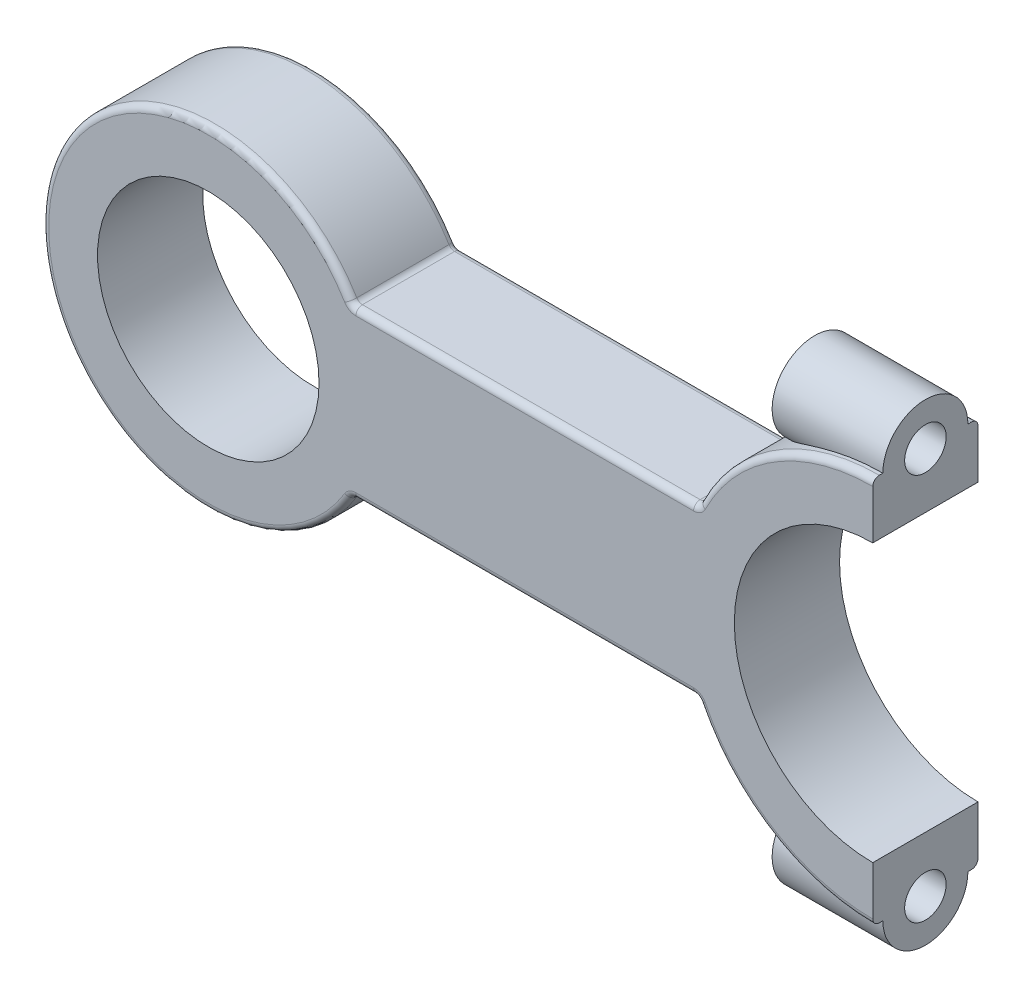
from build123d import *

# Parameters (mm, degrees)
BOSS_EXTRUDE2_DEPTH     = 12.065
CUT_EXTRUDE2_DEPTH      = 161.573408135
CUT_EXTRUDE2_DEPTH_BACK = 161.573408135
SKETCH4_R               = 25.4
SKETCH5_R               = 9.75
BOSS_EXTRUDE4_DEPTH     = 25.4
CUT_EXTRUDE3_START      = -25.4
SKETCH6_R               = 4.76
CUT_EXTRUDE3_DEPTH      = 224.827453338
FILLET3_R               = 1.5


with BuildPart() as part:
    # Sketch1 → Boss-Extrude2 (new, symmetric)
    with BuildSketch(Plane.XY):
        with BuildLine():
            Line((152.4, 31.75), (152.4, 44.45))
            ThreePointArc((152.4, 44.45), (128.640475594, 37.567106623), (112.239073716, 19.05))
            Line((112.239073716, 19.05), (32.995567884, 19.05))
            ThreePointArc((32.995567884, 19.05), (-38.1, 0), (32.995567884, -19.05))
            Line((32.995567884, -19.05), (112.239073716, -19.05))
            ThreePointArc((112.239073716, -19.05), (128.640475594, -37.567106623), (152.4, -44.45))
            Line((152.4, -44.45), (152.4, -31.75))
            ThreePointArc((152.4, -31.75), (120.65, 0), (152.4, 31.75))
        make_face()
    extrude(amount=BOSS_EXTRUDE2_DEPTH, both=True)

    # Sketch4 → Cut-Extrude2 (cut, two sides: drawn at the far end of the back side and taken through both)
    with BuildSketch(Plane.XY.offset(12.065).offset(-CUT_EXTRUDE2_DEPTH_BACK)):
        Circle(SKETCH4_R)
    extrude(amount=CUT_EXTRUDE2_DEPTH + CUT_EXTRUDE2_DEPTH_BACK, mode=Mode.SUBTRACT)

    # Sketch5 → Boss-Extrude4 (add)
    with BuildSketch(Plane(origin=(152.4, 0, 0), x_dir=(0, 0, -1), z_dir=(1, 0, 0))):
        with Locations((0, 44.45)):
            Circle(SKETCH5_R)
    boss_extrude4 = extrude(amount=-BOSS_EXTRUDE4_DEPTH)

    # Sketch6 → Cut-Extrude3 (cut)
    with BuildSketch(Plane(origin=(152.4, 0, 0), x_dir=(0, 0, -1), z_dir=(1, 0, 0)).offset(CUT_EXTRUDE3_START)):
        with Locations((0, 44.45)):
            Circle(SKETCH6_R)
    cut_extrude3 = extrude(amount=CUT_EXTRUDE3_DEPTH, mode=Mode.SUBTRACT)

    # Mirror2: Boss-Extrude4, Cut-Extrude3 across plane
    add(boss_extrude4.mirror(Plane.ZX))
    add(cut_extrude3.mirror(Plane.ZX), mode=Mode.SUBTRACT)

    # Fillet3
    fillet3_edges = [part.edges().sort_by_distance(p)[0] for p in [
        (72.6173208, -19.05, -12.065),
        (72.6173208, -19.05, 12.065),
        (72.6173208, 19.05, 12.065),
        (72.6173208, 19.05, -12.065),
        (-38.1, 0, 12.065),
        (-38.1, 0, -12.065),
        (128.640475594, -37.567106623, 12.065),
        (128.640475594, -37.567106623, -12.065),
        (128.640475594, 37.567106623, 12.065),
        (128.640475594, 37.567106623, -12.065),
        (32.995567884, -19.05, 0),
        (112.239073716, -19.05, 0),
        (112.239073716, 19.05, 0),
        (32.995567884, 19.05, 0),
    ]]
    fillet(fillet3_edges, radius=FILLET3_R)


solid = part.part
